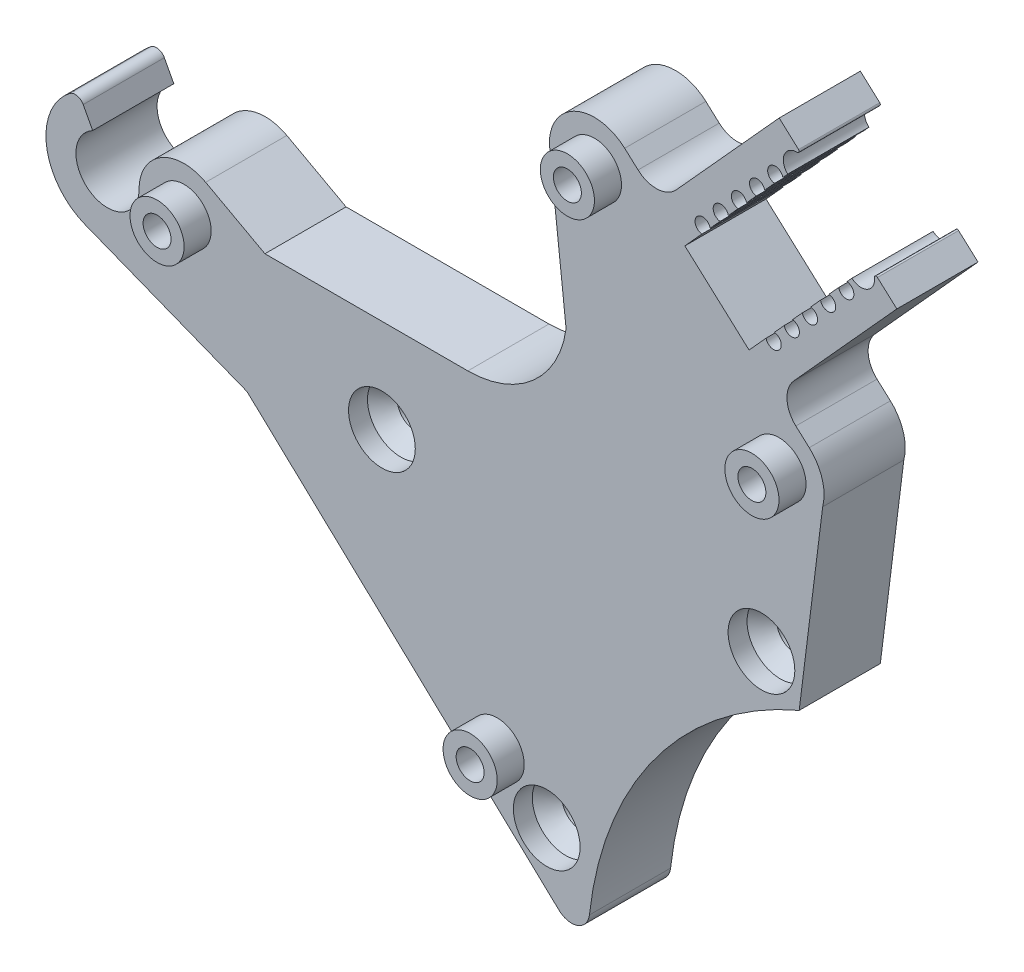
from build123d import *

# Parameters (mm, degrees)
SKETCH2_R           = 1.55
SKETCH2_R_2         = 2.05
BOSS_EXTRUDE1_DEPTH = 12
FILLET1_R           = 2
CUT_EXTRUDE1_START  = -3
SKETCH3_R           = 3
SKETCH3_R_2         = 2.05
CUT_EXTRUDE1_DEPTH  = 3
SKETCH4_R           = 3.7
CUT_EXTRUDE2_DEPTH  = 4.5
CHAMFER1_SIZE       = 2.4
SKETCH5_R           = 2.75
CUT_EXTRUDE3_DEPTH  = 3
BOSS_EXTRUDE2_START = -9
BOSS_EXTRUDE2_DEPTH = 9
FILLET2_R           = 1
BOSS_EXTRUDE3_DEPTH = 9
FILLET4_START       = -1
FILLET4_DEPTH       = 11
FILLET5_R           = 3


with BuildPart() as part:
    # Sketch2 → Boss-Extrude1 (new body)
    with BuildSketch(Plane.XY):
        with BuildLine():
            ThreePointArc((-34.361900506, 79.761980688), (-39.745042243, 80.625629102), (-42.717452598, 76.055193649))
            Line((-42.717452598, 76.055193649), (-40.859246047, 59.183225371))
            ThreePointArc((-40.859246047, 59.183225371), (-44.528699852, 52.393377917), (-51.756139987, 49.685790659))
            Line((-51.756139987, 49.685790659), (-74.256139987, 49.685790659))
            Line((-74.256139987, 49.685790659), (-80.823457728, 53.261259171))
            ThreePointArc((-80.823457728, 53.261259171), (-87.265010513, 51.801013702), (-86.637858855, 45.225863521))
            Line((-86.637858855, 45.225863521), (-38.5, 0))
            ThreePointArc((-38.5, 0), (-32.095751713, 21.262942459), (-15.013624831, 35.451954381))
            Line((-15.013624831, 35.451954381), (-12.409566879, 56.302830298))
            ThreePointArc((-12.409566879, 56.302830298), (-12.469511691, 58.978105921), (-13.900436048, 61.239333138))
            Line((-13.900436048, 61.239333138), (-34.361900506, 79.761980688))
        make_face()
        with Locations((-37.717452598, 76.055193649)):
            Circle(SKETCH2_R, mode=Mode.SUBTRACT)
        with Locations((-19.197703686, 39.030816229)):
            Circle(SKETCH2_R_2, mode=Mode.SUBTRACT)
        with Locations((-43.007240778, 10.171842851)):
            Circle(SKETCH2_R_2, mode=Mode.SUBTRACT)
        with Locations((-48.5, 15)):
            Circle(SKETCH2_R, mode=Mode.SUBTRACT)
        with Locations((-61.282634195, 39.291280842)):
            Circle(SKETCH2_R_2, mode=Mode.SUBTRACT)
        with Locations((-17.255988141, 57.532546099)):
            Circle(SKETCH2_R, mode=Mode.SUBTRACT)
        with Locations((-83.214262364, 48.86989797)):
            Circle(SKETCH2_R, mode=Mode.SUBTRACT)
    extrude(amount=BOSS_EXTRUDE1_DEPTH)

    # Fillet1
    fillet1_edges = [part.edges().sort_by_distance(p)[0] for p in [
        (-38.5, 0, 6),
    ]]
    fillet(fillet1_edges, radius=FILLET1_R)

    # Sketch3 → Cut-Extrude1 (cut)
    with BuildSketch(Plane.XY.offset(12).offset(CUT_EXTRUDE1_START)):
        with BuildLine():
            ThreePointArc((-80.823457728, 53.261259171), (-87.265010513, 51.801013702), (-86.637858855, 45.225863521))
            Line((-86.637858855, 45.225863521), (-41.629914465, 2.94057708))
            ThreePointArc((-41.629914465, 2.94057708), (-39.567390321, 2.522122518), (-38.272304221, 4.180996249))
            ThreePointArc((-38.272304221, 4.180996249), (-30.892001624, 22.976819529), (-15.013624831, 35.451954381))
            Line((-15.013624831, 35.451954381), (-12.409566879, 56.302830298))
            ThreePointArc((-12.409566879, 56.302830298), (-12.469511691, 58.978105921), (-13.900436048, 61.239333138))
            Line((-13.900436048, 61.239333138), (-34.361900506, 79.761980688))
            ThreePointArc((-34.361900506, 79.761980688), (-39.745042243, 80.625629102), (-42.717452598, 76.055193649))
            Line((-42.717452598, 76.055193649), (-40.859246047, 59.183225371))
            ThreePointArc((-40.859246047, 59.183225371), (-44.528699852, 52.393377917), (-51.756139987, 49.685790659))
            Line((-51.756139987, 49.685790659), (-74.256139987, 49.685790659))
            Line((-74.256139987, 49.685790659), (-80.823457728, 53.261259171))
        make_face()
        with Locations((-83.214262364, 48.86989797)):
            Circle(SKETCH3_R, mode=Mode.SUBTRACT)
        with Locations((-48.5, 15)):
            Circle(SKETCH3_R, mode=Mode.SUBTRACT)
        with Locations((-37.717452598, 76.055193649)):
            Circle(SKETCH3_R, mode=Mode.SUBTRACT)
        with Locations((-17.255988141, 57.532546099)):
            Circle(SKETCH3_R, mode=Mode.SUBTRACT)
        with Locations((-19.197703686, 39.030816229)):
            Circle(SKETCH3_R_2, mode=Mode.SUBTRACT)
        with Locations((-61.282634195, 39.291280842)):
            Circle(SKETCH3_R_2, mode=Mode.SUBTRACT)
        with Locations((-43.007240778, 10.171842851)):
            Circle(SKETCH3_R_2, mode=Mode.SUBTRACT)
    extrude(amount=CUT_EXTRUDE1_DEPTH, mode=Mode.SUBTRACT)

    # Sketch4 → Cut-Extrude2 (cut)
    with BuildSketch(Plane.XY.offset(9)):
        with Locations((-19.197703686, 39.030816229)):
            Circle(SKETCH4_R)
        with Locations((-61.282634195, 39.291280842)):
            Circle(SKETCH4_R)
        with Locations((-43.007240778, 10.171842851)):
            Circle(SKETCH4_R)
    extrude(amount=-CUT_EXTRUDE2_DEPTH, mode=Mode.SUBTRACT)

    # Chamfer1
    # the kernel refuses this chamfer: 2.4 mm, written as the material it adds along each edge
    with BuildSketch(Plane(origin=(-19.197703686, 39.030816229, 4.5), x_dir=(1, 0, 0), z_dir=(0, -1, 0))) as chamfer1_piece_1_section:
        Polygon((3.7, CHAMFER1_SIZE), (3.7 - CHAMFER1_SIZE, 0), (3.7, 0), align=None)
    chamfer1_piece_1 = revolve(axis=Axis((-19.197703686, 39.030816229, 4.5), (0, 0, 1)), mode=Mode.PRIVATE)
    chamfer1_piece_1 = chamfer1_piece_1 - Plane(origin=(-19.197703686, 39.030816229, 4.5), x_dir=(1, 0, 0), z_dir=(0, 0, -1)) * Cylinder(2.05, 15, mode=Mode.PRIVATE)
    add(chamfer1_piece_1)
    with BuildSketch(Plane(origin=(-61.282634195, 39.291280842, 4.5), x_dir=(1, 0, 0), z_dir=(0, -1, 0))) as chamfer1_piece_2_section:
        Polygon((3.7, CHAMFER1_SIZE), (3.7 - CHAMFER1_SIZE, 0), (3.7, 0), align=None)
    chamfer1_piece_2 = revolve(axis=Axis((-61.282634195, 39.291280842, 4.5), (0, 0, 1)), mode=Mode.PRIVATE)
    chamfer1_piece_2 = chamfer1_piece_2 - Plane(origin=(-61.282634195, 39.291280842, 4.5), x_dir=(1, 0, 0), z_dir=(0, 0, -1)) * Cylinder(2.05, 15, mode=Mode.PRIVATE)
    add(chamfer1_piece_2)
    with BuildSketch(Plane(origin=(-43.007240778, 10.171842851, 4.5), x_dir=(1, 0, 0), z_dir=(0, -1, 0))) as chamfer1_piece_3_section:
        Polygon((3.7, CHAMFER1_SIZE), (3.7 - CHAMFER1_SIZE, 0), (3.7, 0), align=None)
    chamfer1_piece_3 = revolve(axis=Axis((-43.007240778, 10.171842851, 4.5), (0, 0, 1)), mode=Mode.PRIVATE)
    chamfer1_piece_3 = chamfer1_piece_3 - Plane(origin=(-43.007240778, 10.171842851, 4.5), x_dir=(1, 0, 0), z_dir=(0, 0, -1)) * Cylinder(2.05, 15, mode=Mode.PRIVATE)
    add(chamfer1_piece_3)

    # Sketch5 → Cut-Extrude3 (cut)
    with BuildSketch(Plane(origin=(0, 0, 0), x_dir=(-1, 0, 0), z_dir=(0, 0, -1))):
        with Locations((37.717452598, 76.055193649)):
            Circle(SKETCH5_R)
        with Locations((83.214262364, 48.86989797)):
            Circle(SKETCH5_R)
        with Locations((17.255988141, 57.532546099)):
            Circle(SKETCH5_R)
        with Locations((48.5, 15)):
            Circle(SKETCH5_R)
    extrude(amount=-CUT_EXTRUDE3_DEPTH, mode=Mode.SUBTRACT)

    # Sketch6 → Boss-Extrude2 (add)
    with BuildSketch(Plane.XY.offset(9).offset(BOSS_EXTRUDE2_START)):
        with BuildLine():
            ThreePointArc((-88.214262364, 48.86989797), (-93.517038002, 45.86989797), (-93.357119507, 51.960370492))
            Line((-93.357119507, 51.960370492), (-94.916514756, 54.893838074))
            ThreePointArc((-94.916514756, 54.893838074), (-98.525385911, 48.481477098), (-94.210921521, 42.520963587))
            ThreePointArc((-94.210921521, 42.520963587), (-89.820992141, 42.315677756), (-86.216712067, 44.830193095))
            Line((-86.216712067, 44.830193095), (-86.637858855, 45.225863521))
            ThreePointArc((-86.637858855, 45.225863521), (-87.803270016, 46.884700557), (-88.214262364, 48.86989797))
        make_face()
        with BuildLine():
            ThreePointArc((-86.216712067, 44.830193095), (-89.820992141, 42.315677756), (-94.210921521, 42.520963587))
            Line((-94.210921521, 42.520963587), (-76.234628888, 35.451954381))
            Line((-76.234628888, 35.451954381), (-86.216712067, 44.830193095))
        make_face()
    extrude(amount=BOSS_EXTRUDE2_DEPTH)

    # Fillet2
    fillet2_edges = [part.edges().sort_by_distance(p)[0] for p in [
        (-94.916514756, 54.893838074, 4.5),
    ]]
    fillet(fillet2_edges, radius=FILLET2_R)

    # Sketch7 → Boss-Extrude3 (add)
    with BuildSketch(Plane.XY.offset(9)):
        with BuildLine():
            Line((-20.572652719, 67.279326905), (-17.607223088, 64.594885231))
            Line((-17.607223088, 64.594885231), (-4.185014718, 79.422033388))
            Line((-4.185014718, 79.422033388), (-7.15044435, 82.106475062))
            ThreePointArc((-7.15044435, 82.106475062), (-7.045073866, 79.987773323), (-9.163775605, 79.882402839))
            Line((-9.163775605, 79.882402839), (-9.709129089, 79.279965693))
            ThreePointArc((-9.709129089, 79.279965693), (-9.169608732, 77.864367662), (-10.631753377, 78.260767761))
            Line((-10.631753377, 78.260767761), (-11.722460344, 77.055893469))
            ThreePointArc((-11.722460344, 77.055893469), (-11.182939988, 75.640295438), (-12.645084632, 76.036695537))
            Line((-12.645084632, 76.036695537), (-13.7357916, 74.831821245))
            ThreePointArc((-13.7357916, 74.831821245), (-13.196271243, 73.416223215), (-14.658415888, 73.812623314))
            Line((-14.658415888, 73.812623314), (-15.749122855, 72.607749022))
            ThreePointArc((-15.749122855, 72.607749022), (-15.209602499, 71.192150991), (-16.671747143, 71.58855109))
            Line((-16.671747143, 71.58855109), (-17.762454111, 70.383676798))
            ThreePointArc((-17.762454111, 70.383676798), (-17.222933754, 68.968078767), (-18.685078398, 69.364478866))
            Line((-18.685078398, 69.364478866), (-20.572652719, 67.279326905))
        make_face()
        with BuildLine():
            Line((-16.826160205, 85.72262571), (-16.280806721, 86.325062856))
            ThreePointArc((-16.280806721, 86.325062856), (-16.386177205, 88.443764595), (-14.267475465, 88.54913508))
            Line((-14.267475465, 88.54913508), (-17.232905097, 91.233576753))
            Line((-17.232905097, 91.233576753), (-30.655113466, 76.406428596))
            Line((-30.655113466, 76.406428596), (-27.689683835, 73.721986922))
            Line((-27.689683835, 73.721986922), (-25.802109514, 75.807138884))
            ThreePointArc((-25.802109514, 75.807138884), (-26.341629871, 77.222736915), (-24.879485226, 76.826336815))
            Line((-24.879485226, 76.826336815), (-23.788778259, 78.031211107))
            ThreePointArc((-23.788778259, 78.031211107), (-24.328298615, 79.446809138), (-22.866153971, 79.050409039))
            Line((-22.866153971, 79.050409039), (-21.775447003, 80.255283331))
            ThreePointArc((-21.775447003, 80.255283331), (-22.31496736, 81.670881362), (-20.852822715, 81.274481263))
            Line((-20.852822715, 81.274481263), (-19.762115748, 82.479355555))
            ThreePointArc((-19.762115748, 82.479355555), (-20.301636104, 83.894953585), (-18.83949146, 83.498553486))
            Line((-18.83949146, 83.498553486), (-17.748784492, 84.703427778))
            ThreePointArc((-17.748784492, 84.703427778), (-18.288304849, 86.119025809), (-16.826160205, 85.72262571))
        make_face()
    extrude(amount=-BOSS_EXTRUDE3_DEPTH)

    # Fillet4: read off the stored shape, not the designer's step
    # Fillet4 outline → Fillet4 (cut)
    with BuildSketch(Plane.XY.offset(FILLET4_START)):
        with BuildLine():
            ThreePointArc((-6.670733599, 81.196144833), (-6.565789093, 81.399975343), (-6.338327999, 81.371310433))
            Line((-6.338327999, 81.371310433), (-7.15044435, 82.106475062))
            ThreePointArc((-7.15044435, 82.106475062), (-6.830087034, 81.693731527), (-6.670733599, 81.196144833))
        make_face()
        with BuildLine():
            ThreePointArc((-15.079591816, 89.284299709), (-15.0284993, 89.060805232), (-15.220911217, 88.936154197))
            ThreePointArc((-15.220911217, 88.936154197), (-14.709968629, 88.826958469), (-14.267475465, 88.54913508))
            Line((-14.267475465, 88.54913508), (-15.079591816, 89.284299709))
        make_face()
    extrude(amount=FILLET4_DEPTH, mode=Mode.SUBTRACT)

    # Fillet5
    fillet5_edges = [part.edges().sort_by_distance(p)[0] for p in [
        (-17.607223088, 64.594885231, 4.5),
        (-30.655113466, 76.406428596, 4.5),
    ]]
    fillet(fillet5_edges, radius=FILLET5_R)


solid = part.part
